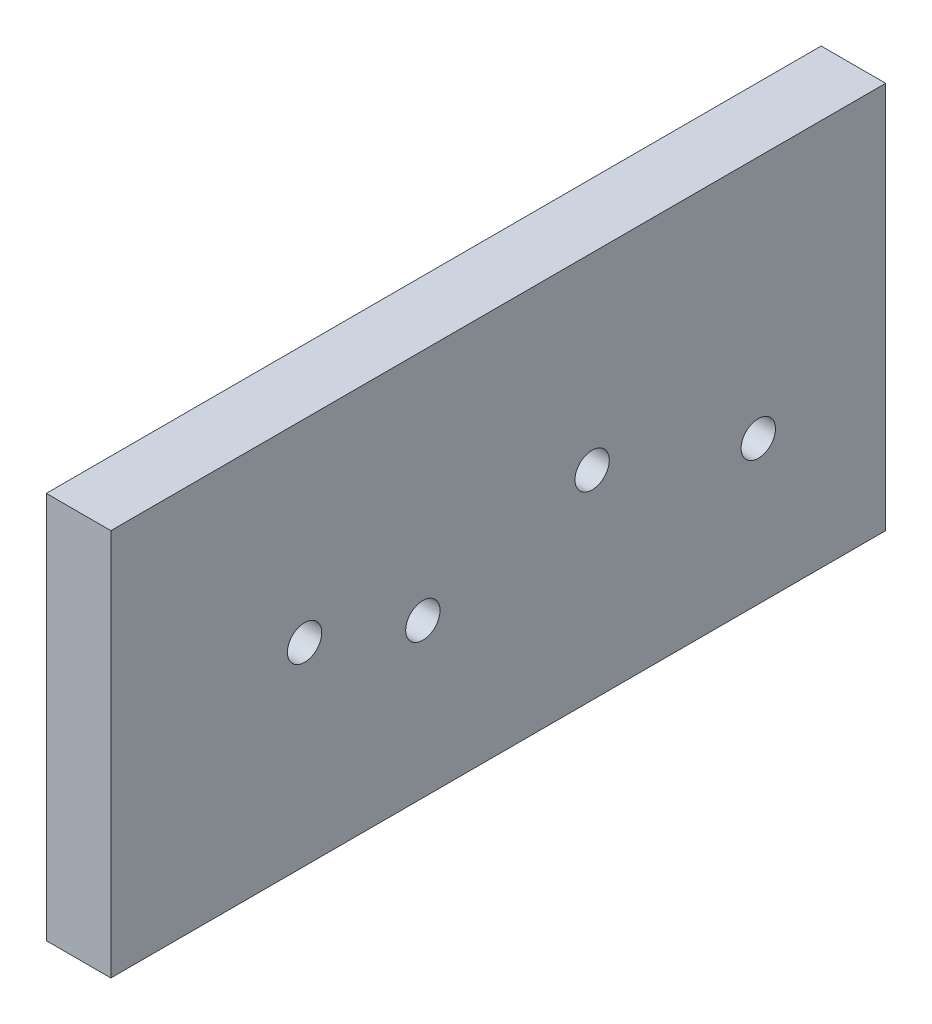
from build123d import *

# Parameters (mm, degrees)
SKETCH1_W           = 152.4
SKETCH1_H           = 76.2
SKETCH1_R           = 3.3782
BOSS_EXTRUDE1_DEPTH = 12.7
SKETCH2_R           = 6.223
CUT_EXTRUDE1_DEPTH  = 4.7625


with BuildPart() as part:
    # Sketch1 → Boss-Extrude1 (new body)
    with BuildSketch(Plane(origin=(0, 0, 0), x_dir=(0, 0, -1), z_dir=(1, 0, 0))):
        Rectangle(SKETCH1_W, SKETCH1_H)
        with Locations((18.457733582, 1.096077429)):
            Circle(SKETCH1_R, mode=Mode.SUBTRACT)
        with Locations((-38.1, 0)):
            Circle(SKETCH1_R, mode=Mode.SUBTRACT)
        with Locations((-14.836022013, -7.860160654)):
            Circle(SKETCH1_R, mode=Mode.SUBTRACT)
        with Locations((51.143457994, -9.873506971)):
            Circle(SKETCH1_R, mode=Mode.SUBTRACT)
    extrude(amount=BOSS_EXTRUDE1_DEPTH)

    # Sketch2 → Cut-Extrude1 (cut)
    with BuildSketch(Plane.ZY):
        with Locations((38.1, 0)):
            Circle(SKETCH2_R)
        with Locations((14.836022013, -7.860160654)):
            Circle(SKETCH2_R)
        with Locations((-18.457733582, 1.096077429)):
            Circle(SKETCH2_R)
        with Locations((-51.143457994, -9.873506971)):
            Circle(SKETCH2_R)
    extrude(amount=-CUT_EXTRUDE1_DEPTH, mode=Mode.SUBTRACT)


solid = part.part
